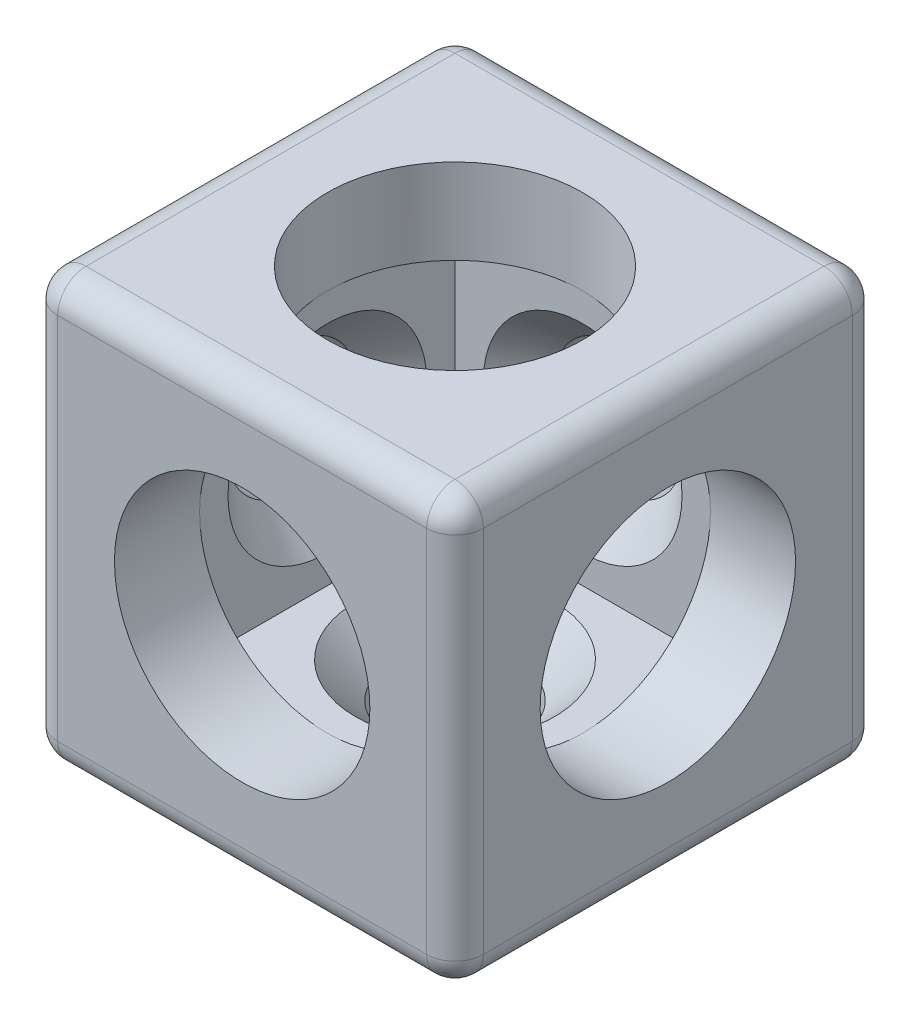
from build123d import *

# Parameters (mm, degrees)
BOSS_EXTRUDE1_DEPTH = 30
FILLET1_R           = 2
SHELL2_T            = 6
SKETCH3_R           = 9
CUT_EXTRUDE1_DEPTH  = 10
SKETCH4_R           = 9
CUT_EXTRUDE2_DEPTH  = 10
SKETCH5_R           = 9
CUT_EXTRUDE3_DEPTH  = 10
SKETCH7_R           = 4.5
CUT_EXTRUDE4_DEPTH  = 10
SKETCH8_R           = 4.5
CUT_EXTRUDE5_DEPTH  = 10
SKETCH9_R           = 4.5
CUT_EXTRUDE6_DEPTH  = 10
CHAMFER2_SIZE       = 2.5


with BuildPart() as part:
    # Sketch1 → Boss-Extrude1 (new body)
    with BuildSketch(Plane.XY):
        with BuildLine():
            Line((2, 0), (28, 0))
            ThreePointArc((28, 0), (29.414213562, 0.585786438), (30, 2))
            Line((30, 2), (30, 28))
            ThreePointArc((30, 28), (29.414213562, 29.414213562), (28, 30))
            Line((28, 30), (2, 30))
            ThreePointArc((2, 30), (0.585786438, 29.414213562), (0, 28))
            Line((0, 28), (0, 2))
            ThreePointArc((0, 2), (0.585786438, 0.585786438), (2, 0))
        make_face()
    extrude(amount=BOSS_EXTRUDE1_DEPTH)

    # Fillet1
    fillet1_edges = [part.edges().sort_by_distance(p)[0] for p in [
        (29.414213562, 0.585786438, 30),
        (15, 0, 0),
        (0.585786438, 0.585786438, 0),
        (30, 15, 30),
        (29.414213562, 29.414213562, 30),
        (15, 30, 30),
        (0.585786438, 29.414213562, 30),
        (0, 15, 30),
        (0.585786438, 0.585786438, 30),
        (15, 0, 30),
        (0, 15, 0),
        (0.585786438, 29.414213562, 0),
        (15, 30, 0),
        (29.414213562, 29.414213562, 0),
        (30, 15, 0),
        (29.414213562, 0.585786438, 0),
    ]]
    fillet(fillet1_edges, radius=FILLET1_R)

    # Shell2 (no face opened: a closed hollow body)
    add(offset(amount=-SHELL2_T, mode=Mode.PRIVATE), mode=Mode.SUBTRACT)

    # Sketch3 → Cut-Extrude1 (cut)
    with BuildSketch(Plane.XY.offset(30)):
        with Locations((15, 15)):
            Circle(SKETCH3_R)
    extrude(amount=-CUT_EXTRUDE1_DEPTH, mode=Mode.SUBTRACT)

    # Sketch4 → Cut-Extrude2 (cut)
    with BuildSketch(Plane(origin=(30, 0, 0), x_dir=(0, 0, -1), z_dir=(1, 0, 0))):
        with Locations((-15, 15)):
            Circle(SKETCH4_R)
    extrude(amount=-CUT_EXTRUDE2_DEPTH, mode=Mode.SUBTRACT)

    # Sketch5 → Cut-Extrude3 (cut)
    with BuildSketch(Plane(origin=(0, 30, 0), x_dir=(1, 0, 0), z_dir=(0, 1, 0))):
        with Locations(Location((15, -15, 0), (0, 0, 270))):
            Circle(SKETCH5_R)
    extrude(amount=-CUT_EXTRUDE3_DEPTH, mode=Mode.SUBTRACT)

    # Sketch7 → Cut-Extrude4 (cut)
    with BuildSketch(Plane.ZY):
        with Locations((15, 15)):
            Circle(SKETCH7_R)
    extrude(amount=-CUT_EXTRUDE4_DEPTH, mode=Mode.SUBTRACT)

    # Sketch8 → Cut-Extrude5 (cut)
    with BuildSketch(Plane(origin=(0, 0, 0), x_dir=(-1, 0, 0), z_dir=(0, 0, -1))):
        with Locations((-15, 15)):
            Circle(SKETCH8_R)
    extrude(amount=-CUT_EXTRUDE5_DEPTH, mode=Mode.SUBTRACT)

    # Sketch9 → Cut-Extrude6 (cut)
    with BuildSketch(Plane.XZ):
        with Locations(Location((15, 15, 0), (0, 0, 270))):
            Circle(SKETCH9_R)
    extrude(amount=-CUT_EXTRUDE6_DEPTH, mode=Mode.SUBTRACT)

    # Chamfer2
    # the kernel refuses this chamfer: 2.5 mm, written as the material it takes off along each edge
    with BuildSketch(Plane(origin=(6, 15, 15), x_dir=(0, 0, 1), z_dir=(0, -1, 0))) as chamfer2_piece_1:
        Polygon((4.5, CHAMFER2_SIZE), (4.5 + CHAMFER2_SIZE, 0), (4.5, 0), align=None)
    revolve(axis=Axis((6, 15, 15), (-1, 0, 0)), mode=Mode.SUBTRACT)
    with BuildSketch(Plane(origin=(15, 15, 6), x_dir=(-1, 0, 0), z_dir=(0, -1, 0))) as chamfer2_piece_2:
        Polygon((4.5, CHAMFER2_SIZE), (4.5 + CHAMFER2_SIZE, 0), (4.5, 0), align=None)
    revolve(axis=Axis((15, 15, 6), (0, 0, -1)), mode=Mode.SUBTRACT)
    with BuildSketch(Plane(origin=(15, 6, 15), x_dir=(0, 0, -1), z_dir=(-1, 0, 0))) as chamfer2_piece_3:
        Polygon((4.5, CHAMFER2_SIZE), (4.5 + CHAMFER2_SIZE, 0), (4.5, 0), align=None)
    revolve(axis=Axis((15, 6, 15), (0, -1, 0)), mode=Mode.SUBTRACT)


solid = part.part
